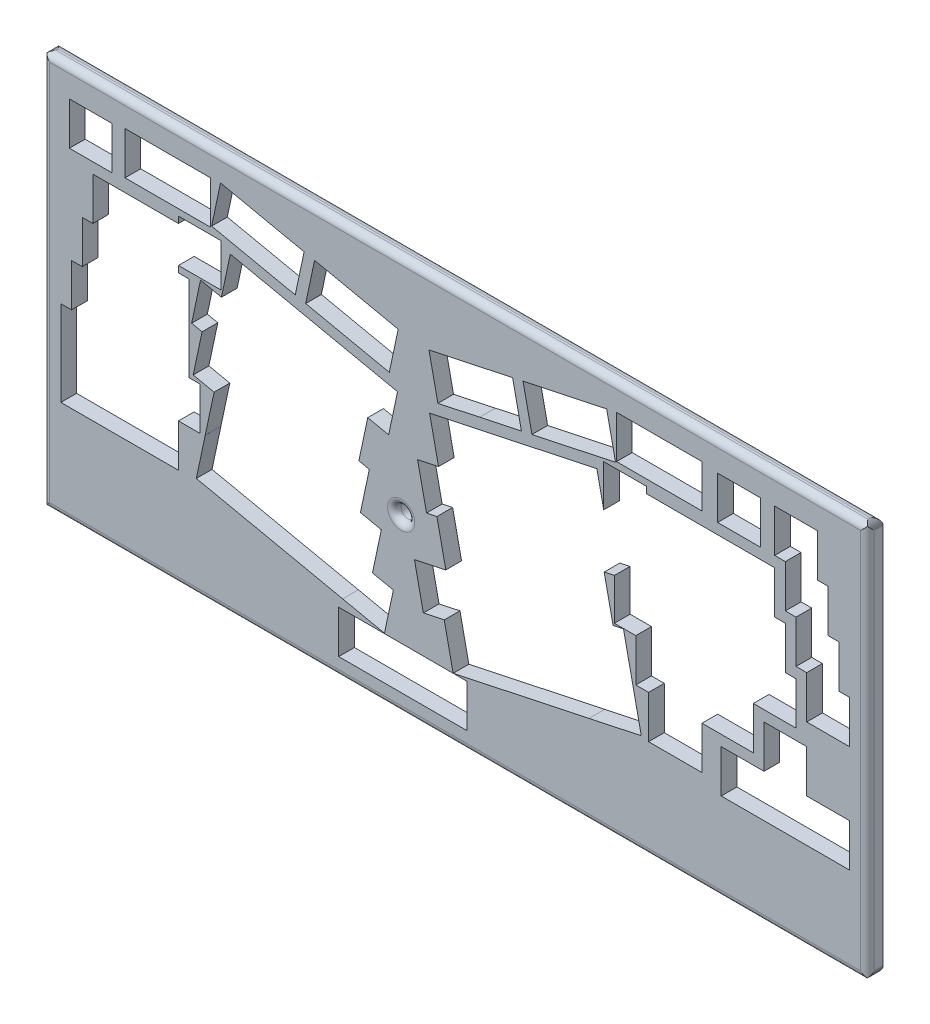
from build123d import *

# Parameters (mm, degrees)
MODEL_R             = 3.048
MODEL_W             = 57.153
MODEL_H             = 19.05134
MODEL_W_2           = 19.051
MODEL_H_2           = 19.052
MODEL_W_3           = 19.0514
MODEL_W_4           = 38.102
MODEL_H_3           = 19.051
MODEL_W_5           = 38.1014
EXTRUDE_1_DEPTH     = 7
SKETCH_4_R          = 1.45
CUT_EXTRUDE_1_DEPTH = 4
FILLET_1_R          = 3


with BuildPart() as part:
    # Model → 凸台-拉伸1 (new body)
    with BuildSketch(Plane.XY):
        Polygon((364.568, 176.294), (364.804, 176.284), (365.037, 176.258), (365.27, 176.211), (365.495, 176.148), (365.718, 176.065), (365.933, 175.967), (366.134, 175.852), (366.332, 175.722), (366.518, 175.576), (366.688, 175.416), (366.85, 175.242), (366.995, 175.058), (367.125, 174.862), (367.242, 174.655), (367.34, 174.442), (367.422, 174.221), (367.485, 173.994), (367.531, 173.764), (367.559, 173.53), (367.57, 173.294), (367.57, 3.27284), (367.559, 3.0372), (367.531, 2.80293), (367.485, 2.5728), (367.422, 2.34542), (367.34, 2.12494), (367.242, 1.91134), (367.125, 1.70601), (366.995, 1.50895), (366.85, 1.3243), (366.688, 1.15204), (366.518, 0.990808), (366.332, 0.844737), (366.134, 0.7152), (365.933, 0.599447), (365.718, 0.501608), (365.495, 0.418924), (365.27, 0.355533), (365.037, 0.310059), (364.804, 0.282498), (364.568, 0.272852), (3.09507, 0.272852), (2.85943, 0.282498), (2.62516, 0.310059), (2.39503, 0.355533), (2.16765, 0.418924), (1.94717, 0.501608), (1.73357, 0.599447), (1.52687, 0.7152), (1.33119, 0.844737), (1.14653, 0.990808), (0.972894, 1.15204), (0.813043, 1.3243), (0.666972, 1.50895), (0.537436, 1.70601), (0.421679, 1.91134), (0.323839, 2.12494), (0.241157, 2.34542), (0.177767, 2.5728), (0.130914, 2.80293), (0.104731, 3.0372), (0.0950846, 3.27284), (0.0950846, 173.294), (0.104731, 173.53), (0.130914, 173.764), (0.177767, 173.994), (0.241157, 174.221), (0.323839, 174.442), (0.421679, 174.655), (0.537436, 174.862), (0.666972, 175.058), (0.813043, 175.242), (0.972894, 175.416), (1.14653, 175.576), (1.33119, 175.722), (1.52687, 175.852), (1.73357, 175.967), (1.94717, 176.065), (2.16765, 176.148), (2.39503, 176.211), (2.62516, 176.258), (2.85943, 176.284), (3.09507, 176.294), align=None)
        with Locations((159.761072396, 76.918747221)):
            Circle(MODEL_R, mode=Mode.SUBTRACT)
        with Locations((160.4945, 17.79803)):
            Rectangle(MODEL_W, MODEL_H, mode=Mode.SUBTRACT)
        Polygon((250.03, 142.577), (250.03, 123.962), (246.978, 138.321), (228.344, 134.359), (228.344, 134.36), (209.71, 130.398), (209.71, 130.4), (172.441, 122.477), (176.401, 103.843), (167.084, 101.863), (171.045, 83.228), (175.704, 84.2176), (179.664, 65.5849), (165.688, 62.6152), (169.649, 43.9787), (178.966, 45.9602), (182.928, 27.3265), (243.487, 40.1987), (266.781, 45.1499), (258.859, 82.4191), (254.201, 81.4296), (250.242, 100.061), (254.791, 101.028), (254.791, 82.568), (264.316, 82.568), (264.316, 63.518), (270.032, 63.518), (270.032, 44.468), (293.846, 44.468), (293.846, 63.518), (316.706, 63.518), (316.706, 82.568), (335.756, 82.568), (335.756, 101.619), (330.994, 101.619), (330.994, 120.669), (326.231, 120.669), (326.231, 139.719), (269.081, 139.719), (269.081, 142.577), align=None, mode=Mode.SUBTRACT)
        Polygon((79.6452, 120.829), (70.328, 122.811), (66.3677, 104.174), (71.0269, 103.185), (67.0648, 84.551), (76.382, 82.5708), (72.4214, 63.9367), (72.4228, 63.9367), (68.4611, 45.303), (133.681, 31.4399), (152.315, 27.4794), (156.275, 46.1148), (146.958, 48.0949), (150.92, 66.7286), (141.603, 68.7091), (145.564, 87.3428), (140.904, 88.3324), (144.865, 106.965), (154.182, 104.985), (158.144, 123.621), (139.507, 127.581), (139.507, 127.58), (83.6069, 139.463), align=None, mode=Mode.SUBTRACT)
        Polygon((321.466, 77.8069), (321.466, 58.7569), (302.416, 58.7569), (302.416, 39.7055), (359.569, 39.7055), (359.569, 58.7569), (340.519, 58.7569), (340.519, 77.8069), align=None, mode=Mode.SUBTRACT)
        Polygon((60.4806, 142.577), (60.4806, 139.719), (22.3821, 139.719), (22.3821, 120.669), (17.6196, 120.669), (17.6196, 101.619), (12.8571, 101.619), (12.8571, 82.5694), (8.09459, 82.5694), (8.09459, 44.468), (60.4834, 44.468), (60.4834, 63.518), (70.0084, 63.518), (70.0084, 82.5694), (65.2459, 82.5694), (65.2459, 120.669), (60.4834, 120.669), (60.4834, 123.526), (79.5334, 123.526), (79.5334, 142.577), align=None, mode=Mode.SUBTRACT)
        Polygon((326.228, 163.532), (326.228, 144.48), (330.991, 144.48), (330.991, 125.43), (335.755, 125.43), (335.755, 106.38), (340.516, 106.38), (340.516, 87.3305), (359.569, 87.3305), (359.569, 106.382), (354.806, 106.382), (354.806, 125.432), (350.044, 125.432), (350.044, 144.482), (345.281, 144.482), (345.281, 163.532), align=None, mode=Mode.SUBTRACT)
        Polygon((172.147, 146.76), (176.109, 128.125), (194.743, 132.085), (213.378, 136.046), (209.418, 154.682), align=None, mode=Mode.SUBTRACT)
        Polygon((117.205, 137.188), (154.474, 129.267), (158.436, 147.902), (121.167, 155.824), align=None, mode=Mode.SUBTRACT)
        Polygon((214.074, 155.671), (218.035, 137.035), (255.305, 144.957), (251.343, 163.594), align=None, mode=Mode.SUBTRACT)
        Polygon((75.2796, 146.101), (112.548, 138.179), (116.509, 156.814), (97.875, 160.776), (97.875, 160.774), (79.2399, 164.735), align=None, mode=Mode.SUBTRACT)
        with Locations((310.3235, 154.006)):
            Rectangle(MODEL_W_2, MODEL_H_2, mode=Mode.SUBTRACT)
        with Locations((21.4306, 154.006)):
            Rectangle(MODEL_W_3, MODEL_H_2, mode=Mode.SUBTRACT)
        with Locations((274.795, 154.9585)):
            Rectangle(MODEL_W_4, MODEL_H_3, mode=Mode.SUBTRACT)
        with Locations((55.7202, 154.9585)):
            Rectangle(MODEL_W_5, MODEL_H_3, mode=Mode.SUBTRACT)
    extrude(amount=EXTRUDE_1_DEPTH)

    # 草图4 → 切除-拉伸1 (cut)
    with BuildSketch(Plane(origin=(0, 0, 0), x_dir=(-1, 0, 0), z_dir=(0, 0, -1))):
        with Locations((-363.569924039, 4.275052769)):
            Circle(SKETCH_4_R)
        with Locations((-291.673, 4.27193)):
            Circle(SKETCH_4_R)
        with Locations((-219.779, 4.27193)):
            Circle(SKETCH_4_R)
        with Locations((-147.884, 4.27193)):
            Circle(SKETCH_4_R)
        with Locations((-75.98925, 4.27193)):
            Circle(SKETCH_4_R)
        with Locations((-4.094835, 4.27193)):
            Circle(SKETCH_4_R)
        with Locations((-4.094835, 88.284)):
            Circle(SKETCH_4_R)
        with Locations((-4.094835, 172.293)):
            Circle(SKETCH_4_R)
        with Locations((-75.98925, 172.293)):
            Circle(SKETCH_4_R)
        with Locations((-147.884, 172.293)):
            Circle(SKETCH_4_R)
        with Locations((-219.779, 172.293)):
            Circle(SKETCH_4_R)
        with Locations((-291.673, 172.293)):
            Circle(SKETCH_4_R)
        with Locations((-363.569, 172.293)):
            Circle(SKETCH_4_R)
        with Locations((-363.569, 88.28385)):
            Circle(SKETCH_4_R)
    extrude(amount=-CUT_EXTRUDE_1_DEPTH, mode=Mode.SUBTRACT)

    # 圆角1
    # the kernel refuses this fillet: 3 mm, written as the material it takes off along each edge
    with BuildSketch(Plane(origin=(-4.40493, 176.294, 0), x_dir=(0, 0, 1), z_dir=(1, 0, 0)), Plane(origin=(372.068, 0.272852, 7), x_dir=(0, 1, 0), z_dir=(-1, 0, 0))) as fillet_1_piece_1:
        with BuildLine():
            CenterArc((FILLET_1_R, FILLET_1_R), FILLET_1_R, 180, 90)
            Line((0, FILLET_1_R), (0, 0))
            Line((0, 0), (FILLET_1_R, 0))
        make_face()
    extrude(amount=376.47293, mode=Mode.SUBTRACT)
    with BuildSketch(Plane(origin=(0.0950846, -4.22716, 0), x_dir=(1, 0, 0), z_dir=(0, 1, 0))) as fillet_1_piece_2:
        with BuildLine():
            CenterArc((FILLET_1_R, -FILLET_1_R), FILLET_1_R, 90, 90)
            Line((0, -FILLET_1_R), (0, 0))
            Line((0, 0), (FILLET_1_R, 0))
        make_face()
    extrude(amount=185.02116, mode=Mode.SUBTRACT)
    with BuildSketch(Plane(origin=(372.068, 0.272852, 0), x_dir=(0, 1, 0), z_dir=(-1, 0, 0)), Plane(origin=(-4.40493, 176.294, 7), x_dir=(0, 0, -1), z_dir=(1, 0, 0))) as fillet_1_piece_3:
        with BuildLine():
            CenterArc((FILLET_1_R, -FILLET_1_R), FILLET_1_R, 90, 90)
            Line((0, -FILLET_1_R), (0, 0))
            Line((0, 0), (FILLET_1_R, 0))
        make_face()
    extrude(amount=376.47293, mode=Mode.SUBTRACT)
    with BuildSketch(Plane(origin=(3.09507, 0.272852, -0.153443215), x_dir=(1, 0, 0), z_dir=(0, 0, 1))) as fillet_1_piece_4:
        with BuildLine():
            CenterArc((FILLET_1_R * 0.0204590952928, FILLET_1_R), FILLET_1_R, 267.6558874, 2.3441126)
            Line((-FILLET_1_R * 0.0204419751444, FILLET_1_R * 0.000836798897654), (0, 0))
            Line((0, 0), (FILLET_1_R * 0.0204590952928, 0))
        make_face()
    extrude(amount=7.306886429, mode=Mode.SUBTRACT)
    with BuildSketch(Plane(origin=(364.568, 0.272852, -0.153209344), x_dir=(0.9991657489096021, 0.04083878311010399, 0), z_dir=(0, 0, 1))) as fillet_1_piece_5:
        with BuildLine():
            CenterArc((FILLET_1_R * 0.0204279125592, FILLET_1_R), FILLET_1_R, 267.659459185, 2.340540815)
            Line((-FILLET_1_R * 0.0204108705509, FILLET_1_R * 0.000834251090398), (0, 0))
            Line((0, 0), (FILLET_1_R * 0.0204279125592, 0))
        make_face()
    extrude(amount=7.306418688, mode=Mode.SUBTRACT)
    with BuildSketch(Plane(origin=(0.0950846, 173.294, -0.153215692), x_dir=(0.04084047378676626, 0.9991656798053427, 0), z_dir=(0, 0, 1))) as fillet_1_piece_6:
        with BuildLine():
            CenterArc((FILLET_1_R * 0.0204287589565, -FILLET_1_R), FILLET_1_R, 90, 2.340637765)
            Line((-FILLET_1_R * 0.0204117148303, -FILLET_1_R * 0.000834320194657), (0, 0))
            Line((0, 0), (FILLET_1_R * 0.0204287589565, 0))
        make_face()
    extrude(amount=7.306431384, mode=Mode.SUBTRACT)
    with BuildSketch(Plane(origin=(0.0950846, -4.22716, 7), x_dir=(1, 0, 0), z_dir=(0, 1, 0)), Plane(origin=(367.57, 180.794, 7), x_dir=(-1, 0, 0), z_dir=(0, -1, 0))) as fillet_1_piece_7:
        with BuildLine():
            CenterArc((FILLET_1_R, FILLET_1_R), FILLET_1_R, 180, 90)
            Line((0, FILLET_1_R), (0, 0))
            Line((0, 0), (FILLET_1_R, 0))
        make_face()
    extrude(amount=185.02116, mode=Mode.SUBTRACT)
    with BuildSketch(Plane(origin=(0.0950846, 3.27284, -0.153449572), x_dir=(0, 1, 0), z_dir=(0, 0, 1))) as fillet_1_piece_8:
        with BuildLine():
            CenterArc((FILLET_1_R * 0.0204599429799, -FILLET_1_R), FILLET_1_R, 90, 2.344209698)
            Line((-FILLET_1_R * 0.020442820704, -FILLET_1_R * 0.000836868212693), (0, 0))
            Line((0, 0), (FILLET_1_R * 0.0204599429799, 0))
        make_face()
    extrude(amount=7.306899145, mode=Mode.SUBTRACT)
    with BuildSketch(Plane(origin=(364.568, 176.294, -0.158827045), x_dir=(0.999103476537068, -0.04233489307349842, 0), z_dir=(0, 0, 1))) as fillet_1_piece_9:
        with BuildLine():
            CenterArc((FILLET_1_R * 0.0211769393482, -FILLET_1_R), FILLET_1_R, 90, 2.426335832)
            Line((-FILLET_1_R * 0.0211579537253, -FILLET_1_R * 0.000896523462936), (0, 0))
            Line((0, 0), (FILLET_1_R * 0.0211769393484, 0))
        make_face()
    extrude(amount=7.31765409, mode=Mode.SUBTRACT)
    with BuildSketch(Plane(origin=(3.09507, 176.294, -0.159069476), x_dir=(1, 0, 0), z_dir=(0, 0, 1))) as fillet_1_piece_10:
        with BuildLine():
            CenterArc((FILLET_1_R * 0.0212092634346, -FILLET_1_R), FILLET_1_R, 90, 2.430038236)
            Line((-FILLET_1_R * 0.0211901907671, -FILLET_1_R * 0.000899261193647), (0, 0))
            Line((0, 0), (FILLET_1_R * 0.0212092634346, 0))
        make_face()
    extrude(amount=7.318138952, mode=Mode.SUBTRACT)
    with BuildSketch(Plane(origin=(159.761072396, 76.918747221, 7), x_dir=(1, 0, 0), z_dir=(0, -1, 0))) as fillet_1_piece_11:
        with BuildLine():
            CenterArc((3.048 + FILLET_1_R, -FILLET_1_R), FILLET_1_R, 90, 90)
            Line((3.048, -FILLET_1_R), (3.048, 0))
            Line((3.048, 0), (3.048 + FILLET_1_R, 0))
        make_face()
    revolve(axis=Axis((159.761072396, 76.918747221, 7), (0, 0, 1)), mode=Mode.SUBTRACT)


solid = part.part
